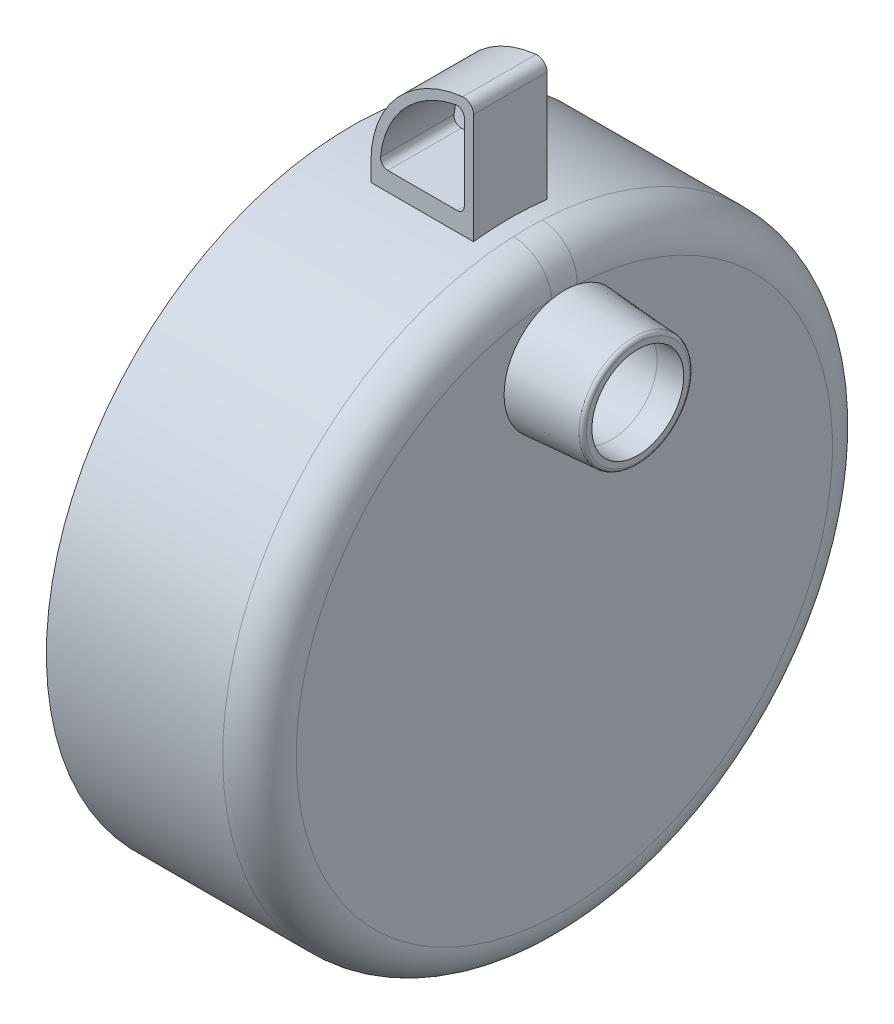
from build123d import *

# Parameters (mm, degrees)
SKETCH2_W           = 6
SKETCH2_H           = 8.3
SHELL1_T            = -0.3
SKETCH5_R           = 1.25
CUT_EXTRUDE1_DEPTH  = 10
FILLET1_R           = 1
FILLET2_R           = 0.1
CHAMFER1_SIZE       = 0.5
BOSS_EXTRUDE1_DEPTH = 1


with BuildPart() as part:
    # Sketch2 → Revolve1 (revolve)
    with BuildSketch(Plane.XY):
        with Locations((-3.662621359, 4.15)):
            Rectangle(SKETCH2_W, SKETCH2_H)
    revolve(axis=Axis((0, 0, 0), (-1, 0, 0)))

    # Sketch3 → Revolve2 (revolve)
    with BuildSketch(Plane.XY, mode=Mode.PRIVATE) as revolve2_sk:
        Polygon((1.337378641, 7.188452486), (-0.662621359, 7.328306109), (-0.662621359, 5.688452486), (1.337378641, 5.688452486), align=None)
    revolve(revolve2_sk.sketch.rotate(Axis((-0.662621359, 5.688452486, 0), (1, 0, 0)), 180), axis=Axis((-0.662621359, 5.688452486, 0), (1, 0, 0)))

    # Shell1
    shell1_openings = [part.faces().sort_by_distance(p)[0] for p in [
        (-6.662621359, 0, 0),
    ]]
    offset(amount=SHELL1_T, openings=shell1_openings, kind=Kind.INTERSECTION)

    # Sketch5 → Cut-Extrude1 (cut)
    with BuildSketch(Plane(origin=(1.337378641, 0, 0), x_dir=(0, 0, -1), z_dir=(1, 0, 0))):
        with Locations((0, 5.688452486)):
            Circle(SKETCH5_R)
    extrude(amount=-CUT_EXTRUDE1_DEPTH, mode=Mode.SUBTRACT)

    # Fillet1
    fillet1_edges = [part.edges().sort_by_distance(p)[0] for p in [
        (-0.662621359, -8.3, 0),
    ]]
    fillet(fillet1_edges, radius=FILLET1_R)

    # Fillet2
    fillet2_edges = [part.edges().sort_by_distance(p)[0] for p in [
        (1.337378641, 7.188452486, 0),
    ]]
    fillet(fillet2_edges, radius=FILLET2_R)

    # Chamfer1
    # the kernel refuses this chamfer: 0.5 mm, written as the material it takes off along each edge
    with BuildSketch(Plane(origin=(-6.662621359, 0, 0), x_dir=(0, 1, 0), z_dir=(0, 0, -1))) as chamfer1_piece_1:
        Polygon((8 + CHAMFER1_SIZE, 0), (8, CHAMFER1_SIZE), (8, 0), align=None)
    revolve(axis=Axis((-6.662621359, 0, 0), (1, 0, 0)), mode=Mode.SUBTRACT)

    # Sketch6 → Boss-Extrude1 (add, symmetric)
    with BuildSketch(Plane.XY):
        with BuildLine():
            Line((-4.927907027, 8.3), (-4.927907027, 8.730333701))
            ThreePointArc((-4.927907027, 8.730333701), (-4.212236683, 10.597628426), (-2.431874659, 11.508279126))
            ThreePointArc((-2.431874659, 11.508279126), (-2.223300905, 11.440869947), (-2.134041341, 11.2406707))
            Line((-2.134041341, 11.2406707), (-2.134041341, 8.115869894))
            Line((-2.134041341, 8.115869894), (-4.927907027, 8.115869894))
            Line((-4.927907027, 8.115869894), (-4.927907027, 7.714440325))
            Line((-4.927907027, 7.714440325), (-4.927907027, 8.3))
        make_face()
        with BuildLine():
            Line((-4.467319737, 8.752860733), (-2.584041341, 8.752860733))
            ThreePointArc((-2.584041341, 8.752860733), (-2.442619985, 8.811439376), (-2.384041341, 8.952860733))
            Line((-2.384041341, 8.952860733), (-2.384041341, 11.030595936))
            ThreePointArc((-2.384041341, 11.030595936), (-2.456918607, 11.184997395), (-2.622439446, 11.226875292))
            ThreePointArc((-2.622439446, 11.226875292), (-4.018863264, 10.438753715), (-4.666416333, 8.971848769))
            ThreePointArc((-4.666416333, 8.971848769), (-4.61530218, 8.818320046), (-4.467319737, 8.752860733))
        make_face(mode=Mode.SUBTRACT)
    extrude(amount=BOSS_EXTRUDE1_DEPTH, both=True)


solid = part.part
